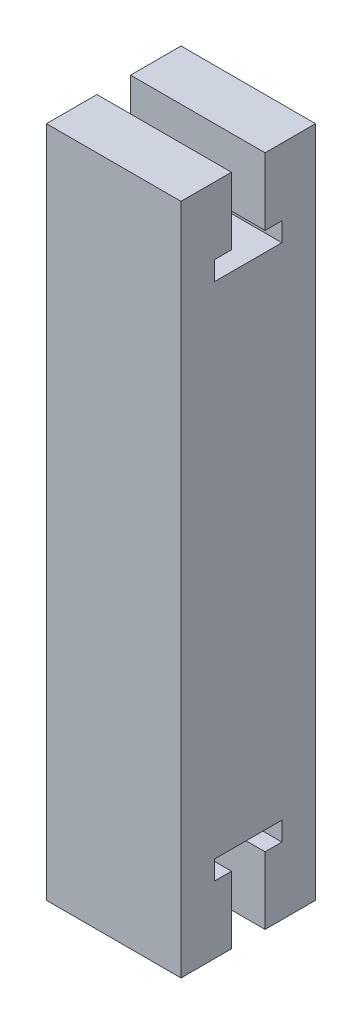
from build123d import *

# Parameters (mm, degrees)
BOSS_EXTRUDE1_DEPTH      = 50
BOSS_EXTRUDE1_DEPTH_BACK = 50
SKETCH1_W                = 20
SKETCH1_H                = 20
CUT_EXTRUDE2_DEPTH       = 58.445626465


with BuildPart() as part:
    # Sketch1 → Boss-Extrude1 (new, two sides: drawn at the far end of the back side and taken through both)
    with BuildSketch(Plane(origin=(0, 0, 0), x_dir=(1, 0, 0), z_dir=(0, 1, 0)).offset(-BOSS_EXTRUDE1_DEPTH_BACK)):
        with Locations((10, -10)):
            Rectangle(SKETCH1_W, SKETCH1_H)
    extrude(amount=BOSS_EXTRUDE1_DEPTH + BOSS_EXTRUDE1_DEPTH_BACK)

    # Sketch3 → Cut-Extrude2 (cut, through all)
    with BuildSketch(Plane.ZY):
        Polygon((7.5, 40), (5, 40), (5, 37.171225458), (15, 37.171225458), (15, 40), (12.5, 40), (12.5, 50), (10, 50), (7.5, 50), align=None)
        Polygon((5, -37.171225458), (5, -40), (7.5, -40), (7.5, -50), (10, -50), (12.5, -50), (12.5, -40), (15, -40), (15, -37.171225458), align=None)
    extrude(amount=-CUT_EXTRUDE2_DEPTH, mode=Mode.SUBTRACT)


solid = part.part
